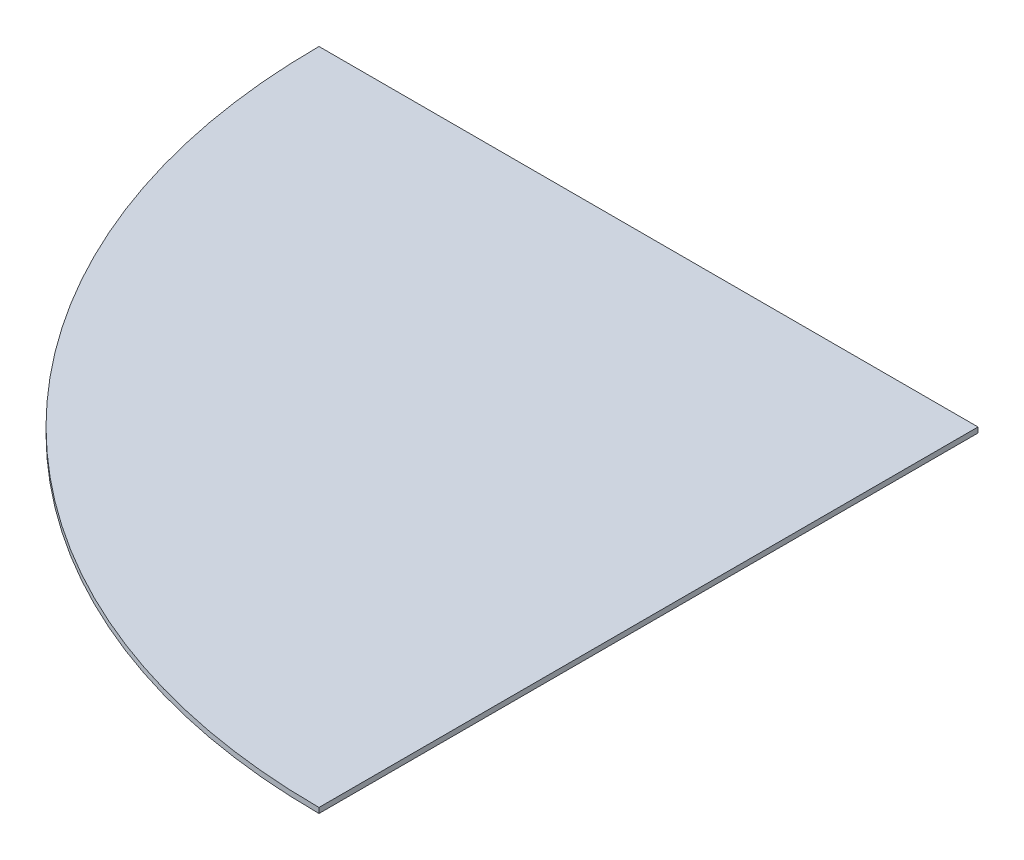
from build123d import *

# Parameters (mm, degrees)
SM_BASE_FLANGE_2_DEPTH = 2


# Sheet-metal steps are written as plain solids
with BuildPart() as part:
    # 草图4 → 基体-法兰2 (new body)
    with BuildSketch(Plane(origin=(0, 500, 0), x_dir=(1, 0, 0), z_dir=(0, 1, 0))):
        with BuildLine():
            Line((-92.5, -92.5), (-342.5, -92.5))
            ThreePointArc((-342.5, -92.5), (-269.276695297, -269.276695297), (-92.5, -342.5))
            Line((-92.5, -342.5), (-92.5, -92.5))
        make_face()
    extrude(amount=-SM_BASE_FLANGE_2_DEPTH)


solid = part.part
